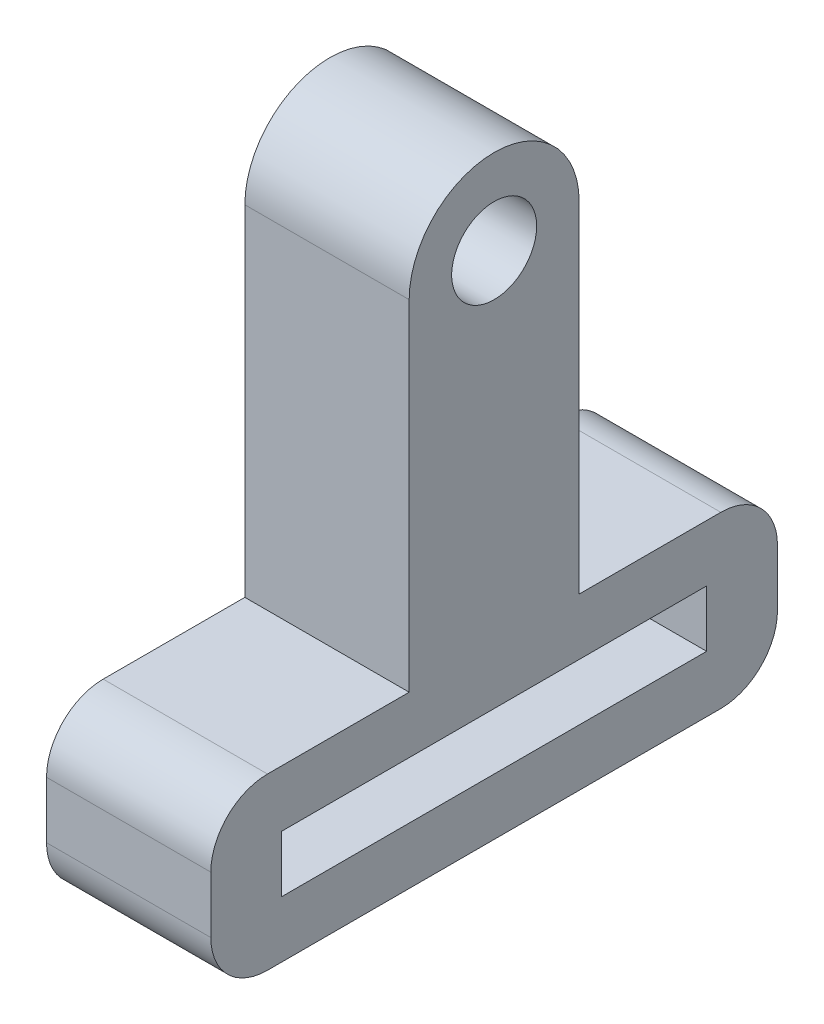
from build123d import *

# Parameters (mm, degrees)
CROQUIS1_R              = 1.5
CROQUIS1_W              = 15
CROQUIS1_H              = 2
SALIENTE_EXTRUIR1_DEPTH = 2.9


with BuildPart() as part:
    # Croquis1 → Saliente-Extruir1 (new, symmetric)
    with BuildSketch(Plane(origin=(0, 0, 0), x_dir=(0, 0, -1), z_dir=(1, 0, 0))):
        with BuildLine():
            Line((-10, 1), (-10, -1))
            ThreePointArc((-10, -1), (-9.414213562, -2.414213562), (-8, -3))
            Line((-8, -3), (8, -3))
            ThreePointArc((8, -3), (9.414213562, -2.414213562), (10, -1))
            Line((10, -1), (10, 1))
            ThreePointArc((10, 1), (9.414213562, 2.414213562), (8, 3))
            Line((8, 3), (3, 3))
            Line((3, 3), (3, 15))
            ThreePointArc((3, 15), (0, 18), (-3, 15))
            Line((-3, 15), (-3, 3))
            Line((-3, 3), (-8, 3))
            ThreePointArc((-8, 3), (-9.414213562, 2.414213562), (-10, 1))
        make_face()
        with Locations((0, 15)):
            Circle(CROQUIS1_R, mode=Mode.SUBTRACT)
        Rectangle(CROQUIS1_W, CROQUIS1_H, mode=Mode.SUBTRACT)
    extrude(amount=SALIENTE_EXTRUIR1_DEPTH, both=True)


solid = part.part
